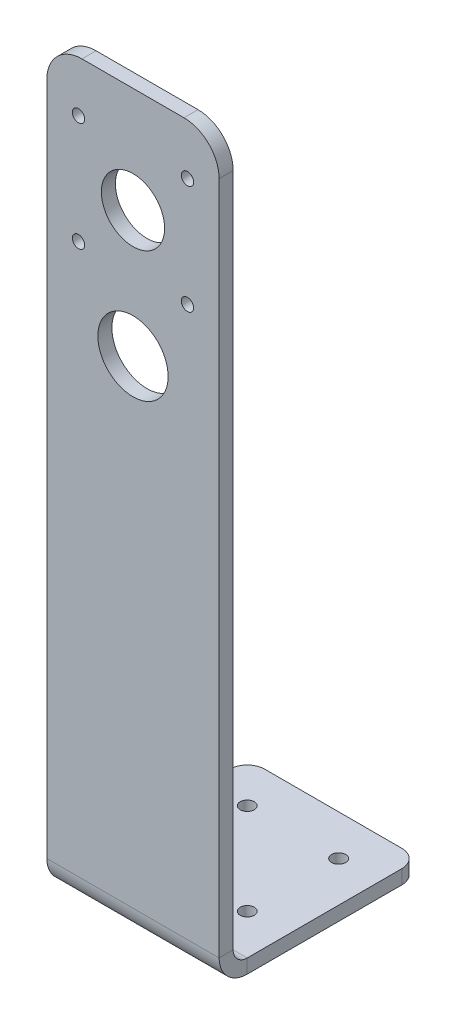
from build123d import *

# Parameters (mm, degrees)
SKETCH1_W          = 49
SKETCH1_H          = 49
SKETCH1_R          = 2
BASE_FLANGE1_DEPTH = 4
EDGE_FLANGE1_DEPTH = 49
SKETCH9_R          = 10
CUT_EXTRUDE1_DEPTH = 10
SKETCH10_R         = 9
SKETCH10_R_2       = 10
SKETCH10_R_3       = 1.75
CUT_EXTRUDE2_DEPTH = 215.115039173
FILLET1_R          = 10
FILLET2_R          = 5


# Sheet-metal steps are written as plain solids
with BuildPart() as part:
    # Sketch1 → Base-Flange1 (new body)
    with BuildSketch(Plane(origin=(0, 0, 0), x_dir=(1, 0, 0), z_dir=(0, 1, 0))):
        Rectangle(SKETCH1_W, SKETCH1_H)
        with Locations(Location((-13, -13, 0), (0, 0, 270))):
            Circle(SKETCH1_R, mode=Mode.SUBTRACT)
        with Locations(Location((-13, 13, 0), (0, 0, 270))):
            Circle(SKETCH1_R, mode=Mode.SUBTRACT)
        with Locations(Location((13, 13, 0), (0, 0, 270))):
            Circle(SKETCH1_R, mode=Mode.SUBTRACT)
        with Locations(Location((13, -13, 0), (0, 0, 270))):
            Circle(SKETCH1_R, mode=Mode.SUBTRACT)
    extrude(amount=-BASE_FLANGE1_DEPTH)

    # Edge-Flange1 section (across the edge) → Edge-Flange1 (add)
    with BuildSketch(Plane(origin=(-24.5, 0, 28.5), x_dir=(0, 0, -1), z_dir=(1, 0, 0))):
        with BuildLine():
            Line((-4, 4), (-4, 206))
            Line((-4, 206), (0, 206))
            Line((0, 206), (0, 4))
            ThreePointArc((0, 4), (1.171572875, 1.171572875), (4, 0))
            Line((4, 0), (4, -4))
            ThreePointArc((4, -4), (-1.656854249, -1.656854249), (-4, 4))
        make_face()
    extrude(amount=EDGE_FLANGE1_DEPTH)

    # Sketch9 → Cut-Extrude1 (cut)
    with BuildSketch(Plane(origin=(0, 0, 28.5), x_dir=(-1, 0, 0), z_dir=(0, 0, -1))):
        with Locations((0, 140)):
            Circle(SKETCH9_R)
    extrude(amount=-CUT_EXTRUDE1_DEPTH, mode=Mode.SUBTRACT)

    # Sketch10 → Cut-Extrude2 (cut, through all)
    with BuildSketch(Plane(origin=(0, 0, 28.5), x_dir=(-1, 0, 0), z_dir=(0, 0, -1))):
        with Locations((0, 176)):
            Circle(SKETCH10_R)
        with Locations((0, 140)):
            Circle(SKETCH10_R_2)
        with Locations((-15.5, 160.5)):
            Circle(SKETCH10_R_3)
        with Locations((-15.5, 191.5)):
            Circle(SKETCH10_R_3)
        with Locations((15.5, 191.5)):
            Circle(SKETCH10_R_3)
        with Locations((15.5, 160.5)):
            Circle(SKETCH10_R_3)
    extrude(amount=-CUT_EXTRUDE2_DEPTH, mode=Mode.SUBTRACT)

    # Fillet1
    fillet1_edges = [part.edges().sort_by_distance(p)[0] for p in [
        (-24.5, 206, 30.5),
        (24.5, 206, 30.5),
    ]]
    fillet(fillet1_edges, radius=FILLET1_R)

    # Fillet2
    fillet2_edges = [part.edges().sort_by_distance(p)[0] for p in [
        (-24.5, -2, -24.5),
        (24.5, -2, -24.5),
    ]]
    fillet(fillet2_edges, radius=FILLET2_R)


solid = part.part
